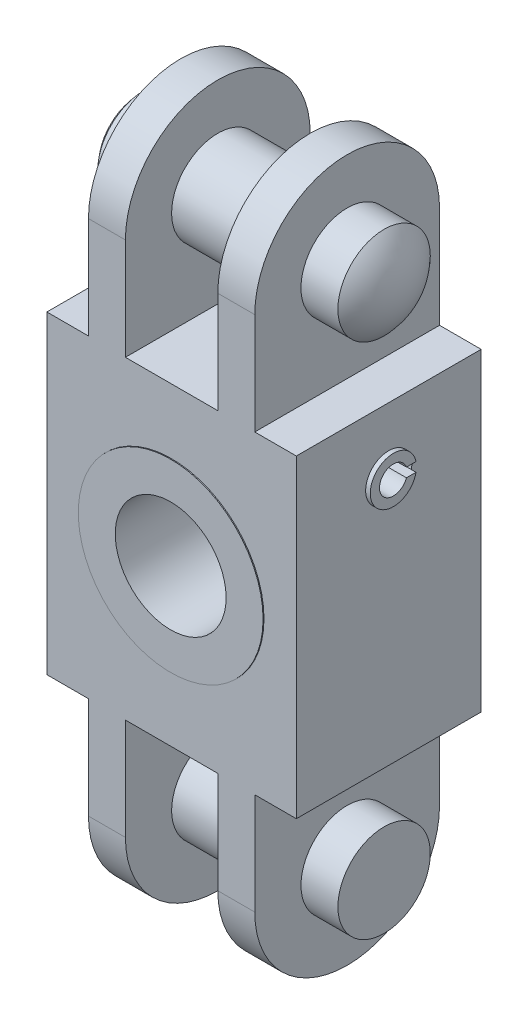
from build123d import *

# Parameters (mm, degrees)
ESQUISSE1_R          = 10
BASE_EXTRUSION_DEPTH = 10
ESQUISSE2_OUTSIDE_W  = 38.62
ESQUISSE2_OUTSIDE_H  = 94.62
D_TOURAGE_DEPTH      = 48.675989764
ESQUISSE3_R          = 5
AL_SAGES_DEPTH       = 46.279686395
ESQUISSE4_R          = 5
AXES_DEPTH           = 13
ESQUISSE5_R          = 10
ESQUISSE5_R_2        = 6
ECROU_RAPPORT_DEPTH  = 10.1
ESQUISSE6_R          = 2.5
PER_AGE_DEPTH        = 49.561919237
GOUPILLE_DEPTH       = 14


# Read off the part's stored shape, not the designer's step: Dôme1, Dôme2
with BuildPart() as part:
    # Esquisse1 → Base-Extrusion (new, symmetric)
    with BuildSketch(Plane.XY):
        Polygon((-13.5, -17), (-13.5, 17), (-9, 17), (-9, 38), (-5, 38), (-5, 17), (5, 17), (5, 38), (9, 38), (9, 17), (13.5, 17), (13.5, -17), (9, -17), (9, -38), (5, -38), (5, -17), (-5, -17), (-5, -38), (-9, -38), (-9, -17), align=None)
        Circle(ESQUISSE1_R, mode=Mode.SUBTRACT)
    extrude(amount=BASE_EXTRUSION_DEPTH, both=True)

    # Esquisse2 outside → Détourage (cut, through all)
    with BuildSketch(Plane.ZY.offset(13.5)):
        Rectangle(ESQUISSE2_OUTSIDE_W, ESQUISSE2_OUTSIDE_H)
        with BuildLine():
            Line((-10, 28), (-10, -28))
            ThreePointArc((-10, -28), (0, -38), (10, -28))
            Line((10, -28), (10, 28))
            ThreePointArc((10, 28), (0, 38), (-10, 28))
        make_face(mode=Mode.SUBTRACT)
    extrude(amount=-D_TOURAGE_DEPTH, mode=Mode.SUBTRACT)

    # Esquisse3 → Alésages (cut, through all)
    with BuildSketch(Plane.ZY.offset(9)):
        with Locations(Location((0, 28, 0), (0, 0, 270))):
            Circle(ESQUISSE3_R)
        with Locations(Location((0, -28, 0), (0, 0, 270))):
            Circle(ESQUISSE3_R)
    extrude(amount=-AL_SAGES_DEPTH, mode=Mode.SUBTRACT)

    # Esquisse4 → Axes (add, symmetric)
    with BuildSketch(Plane(origin=(0, 0, 0), x_dir=(0, 0, -1), z_dir=(1, 0, 0))):
        with Locations(Location((0, -28, 0), (0, 0, 180))):
            Circle(ESQUISSE4_R)
        with Locations(Location((0, 28, 0), (0, 0, 180))):
            Circle(ESQUISSE4_R)
    extrude(amount=AXES_DEPTH, both=True)

    # Dôme1 outline → Dôme1 (revolve)
    with BuildSketch(Plane(origin=(0, 28, 0), x_dir=(0, 1, 0), z_dir=(0, 0, -1))):
        with BuildLine():
            Line((0, 13), (5.000000005, 12.999999995))
            ThreePointArc((5.000000005, 12.999999995), (2.692582407, 14.481456008), (0, 15))
            Line((0, 15), (0, 13))
        make_face()
    revolve(axis=Axis((0, 28, 0), (1, 0, 0)))

    # Dôme2 outline → Dôme2 (revolve)
    with BuildSketch(Plane(origin=(0, 28, 0), x_dir=(0, 1, 0), z_dir=(0, 0, -1))):
        with BuildLine():
            Line((0, -12.999999995), (0, -15))
            ThreePointArc((0, -15), (2.692582407, -14.481456008), (5.000000005, -12.999999995))
            Line((5.000000005, -12.999999995), (0, -12.999999995))
        make_face()
    revolve(axis=Axis((0, 28, 0), (1, 0, 0)))

    # Esquisse5 → Ecrou rapporté (add, symmetric)
    with BuildSketch(Plane.XY):
        Circle(ESQUISSE5_R)
        Circle(ESQUISSE5_R_2, mode=Mode.SUBTRACT)
    extrude(amount=ECROU_RAPPORT_DEPTH, both=True)

    # Esquisse6 → Perçage (cut, through all)
    with BuildSketch(Plane(origin=(13.5, 0, 0), x_dir=(0, 0, -1), z_dir=(1, 0, 0))):
        with Locations((0, 10)):
            Circle(ESQUISSE6_R)
    extrude(amount=-PER_AGE_DEPTH, mode=Mode.SUBTRACT)

    # Esquisse7 → Goupille (add, symmetric)
    with BuildSketch(Plane(origin=(0, 0, 0), x_dir=(0, 0, -1), z_dir=(1, 0, 0))):
        with BuildLine():
            Line((1.414213562, 10.5), (2.449489743, 10.5))
            ThreePointArc((2.449489743, 10.5), (-2.5, 10), (2.449489743, 9.5))
            Line((2.449489743, 9.5), (1.414213562, 9.5))
            ThreePointArc((1.414213562, 9.5), (-1.5, 10), (1.414213562, 10.5))
        make_face()
    extrude(amount=GOUPILLE_DEPTH, both=True)


solid = part.part
